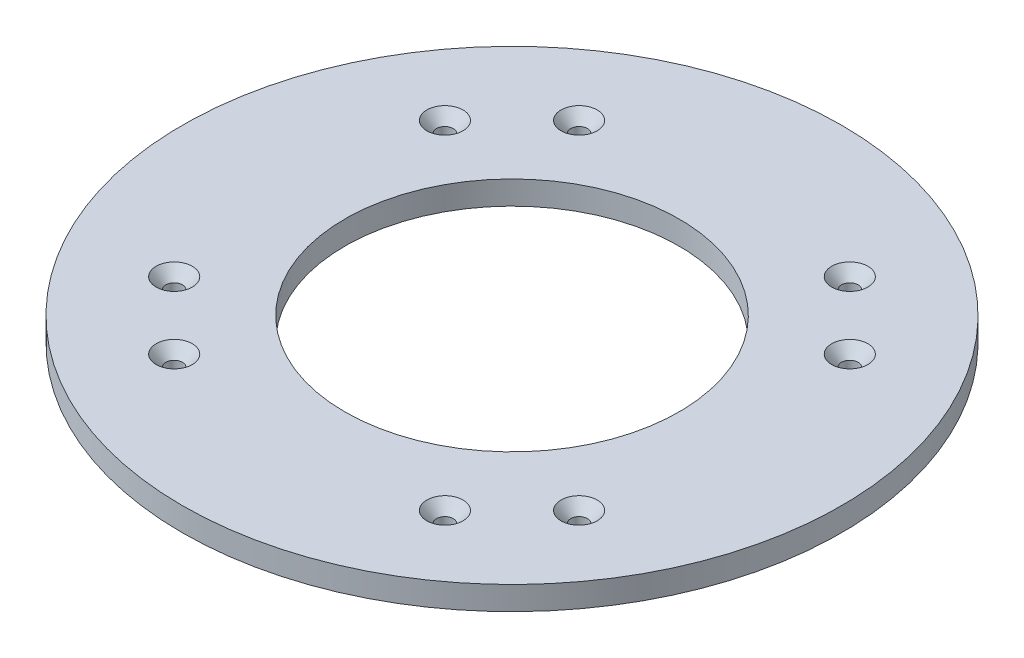
from build123d import *

# Parameters (mm, degrees)
SKETCH1_R                                      = 88.9
BOSS_EXTRUDE1_DEPTH                            = 6.35
CSK_FOR_8_FLAT_HEAD_MACHINE_SCREW1_D           = 4.4958
CSK_FOR_8_FLAT_HEAD_MACHINE_SCREW1_CSINK_D     = 9.7576132
CSK_FOR_8_FLAT_HEAD_MACHINE_SCREW1_CSINK_ANGLE = 82
CIRPATTERN1_COUNT                              = 2
SKETCH4_R                                      = 45.085
CUT_EXTRUDE1_DEPTH                             = 126.88384527


with BuildPart() as part:
    # Sketch1 → Boss-Extrude1 (new body)
    with BuildSketch(Plane(origin=(0, 0, 0), x_dir=(1, 0, 0), z_dir=(0, 1, 0))):
        Circle(SKETCH1_R)
    extrude(amount=BOSS_EXTRUDE1_DEPTH)

    # CSK for #8 Flat Head Machine Screw1 (through all)
    with Locations(Plane(origin=(0, 6.35, 0), x_dir=(-1, 0, 0), z_dir=(0, 1, 0))):
        with Locations((36.5125, -54.61), (-36.5125, -54.61), (36.5125, 54.61), (-36.5125, 54.61), (-54.61, -36.5125), (-54.61, 36.5125), (54.61, 36.5125), (54.61, -36.5125)):
            csk_for_8_flat_head_machine_screw1 = CounterSinkHole(CSK_FOR_8_FLAT_HEAD_MACHINE_SCREW1_D / 2, CSK_FOR_8_FLAT_HEAD_MACHINE_SCREW1_CSINK_D / 2, counter_sink_angle=CSK_FOR_8_FLAT_HEAD_MACHINE_SCREW1_CSINK_ANGLE)

    # CirPattern1: CSK for #8 Flat Head Machine Screw1 ×2 about axis
    cirpattern1_axis = Axis((0, 0, 0), (0, 1, 0))
    for i in range(1, CIRPATTERN1_COUNT):
        add(csk_for_8_flat_head_machine_screw1.rotate(cirpattern1_axis, i * 360 / CIRPATTERN1_COUNT), mode=Mode.SUBTRACT)

    # Sketch4 → Cut-Extrude1 (cut, through all)
    with BuildSketch(Plane(origin=(0, 6.35, 0), x_dir=(1, 0, 0), z_dir=(0, 1, 0))):
        Circle(SKETCH4_R)
    extrude(amount=-CUT_EXTRUDE1_DEPTH, mode=Mode.SUBTRACT)


solid = part.part
